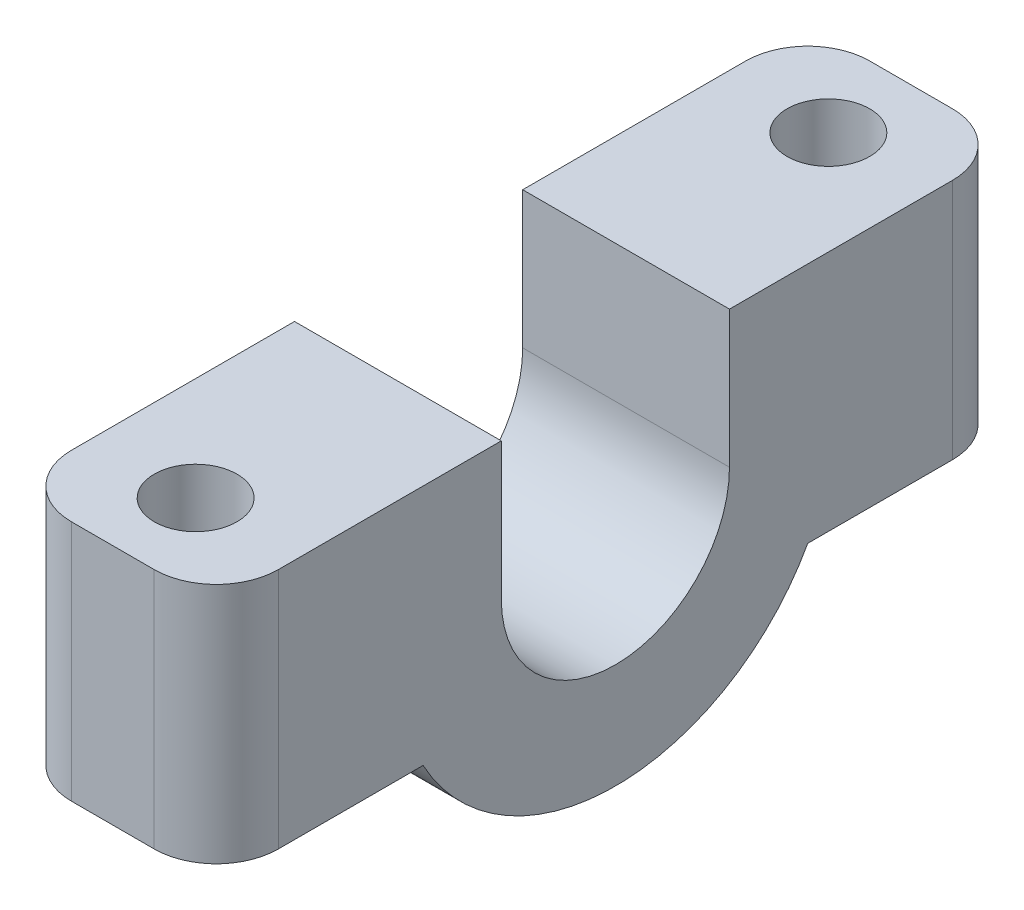
from build123d import *

# Parameters (mm, degrees)
BOSS_EXTRUDE1_DEPTH = 20
CUT_EXTRUDE1_REACH  = 57.463
SKETCH3_R           = 4
FILLET1_R           = 6


with BuildPart() as part:
    # Sketch2 → Boss-Extrude1 (new body)
    with BuildSketch(Plane(origin=(0, 0, 0), x_dir=(0, 0, -1), z_dir=(1, 0, 0))):
        with BuildLine():
            Line((-18.601140422, -10.16), (-38.601140422, -10.16))
            Line((-38.601140422, -10.16), (-38.601140422, 0))
            Line((-38.601140422, 0), (-38.601140422, 13.245))
            Line((-38.601140422, 13.245), (-11.035, 13.245))
            Line((-11.035, 13.245), (-11.035, 0))
            ThreePointArc((-11.035, 0), (0, -11.035), (11.035, 0))
            Line((11.035, 0), (11.035, 13.245))
            Line((11.035, 13.245), (38.601140422, 13.245))
            Line((38.601140422, 13.245), (38.601140422, -10.16))
            Line((38.601140422, -10.16), (18.601140422, -10.16))
            ThreePointArc((18.601140422, -10.16), (0, -21.195), (-18.601140422, -10.16))
        make_face()
    extrude(amount=BOSS_EXTRUDE1_DEPTH)

    # Sketch3 → Cut-Extrude1 (cut, up to next)
    with BuildSketch(Plane(origin=(0, 13.245, 0), x_dir=(1, 0, 0), z_dir=(0, 1, 0)), mode=Mode.PRIVATE) as cut_extrude1_sk1:
        with Locations((10, -30.6)):
            Circle(SKETCH3_R)
    cut_extrude1_tool1 = extrude(cut_extrude1_sk1.sketch, amount=-CUT_EXTRUDE1_REACH, mode=Mode.PRIVATE) & part.part
    # Sketch3 → Cut-Extrude1 (cut, up to next)
    with BuildSketch(Plane(origin=(0, 13.245, 0), x_dir=(1, 0, 0), z_dir=(0, 1, 0)), mode=Mode.PRIVATE) as cut_extrude1_sk2:
        with Locations((10, 30.6)):
            Circle(SKETCH3_R)
    cut_extrude1_tool2 = extrude(cut_extrude1_sk2.sketch, amount=-CUT_EXTRUDE1_REACH, mode=Mode.PRIVATE) & part.part
    add(cut_extrude1_tool1.solids().sort_by_distance((10, 13.245, 30.6))[0], mode=Mode.SUBTRACT)
    add(cut_extrude1_tool2.solids().sort_by_distance((10, 13.245, -30.6))[0], mode=Mode.SUBTRACT)

    # Fillet1
    fillet1_edges = [part.edges().sort_by_distance(p)[0] for p in [
        (0, 1.5425, 38.601140422),
        (20, 1.5425, 38.601140422),
        (20, 1.5425, -38.601140422),
        (0, 1.5425, -38.601140422),
    ]]
    fillet(fillet1_edges, radius=FILLET1_R)


solid = part.part
